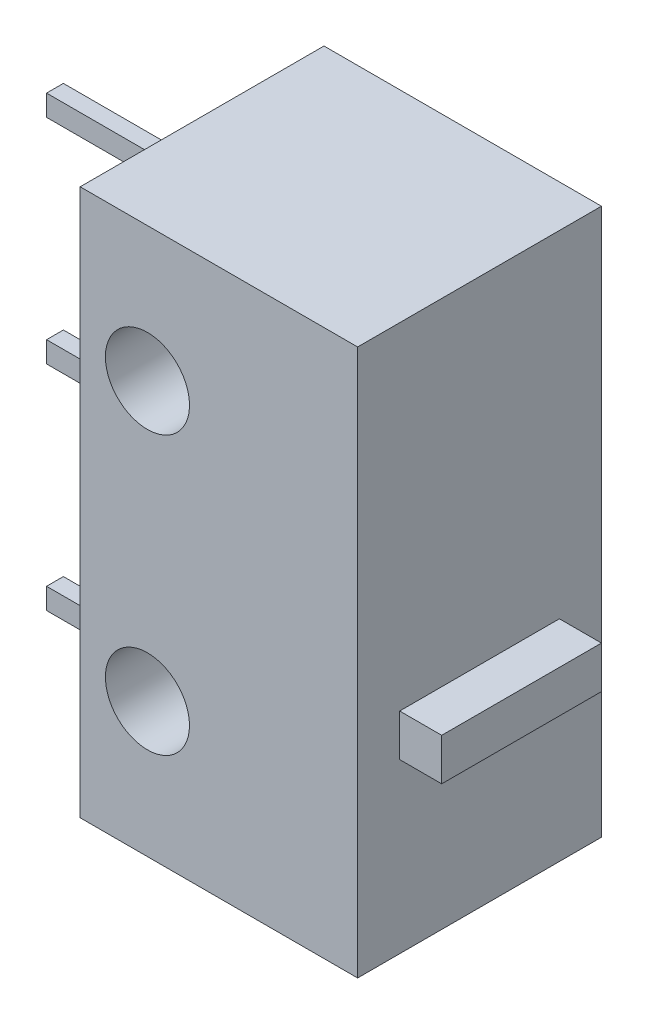
from build123d import *

# Parameters (mm, degrees)
SZKIC1_R                    = 1
DODANIE_WYCI_GNI_CIE1_DEPTH = 5.8
WYTNIJ_WYCI_GNI_CIE1_DEPTH  = 17.136914203


with BuildPart() as part:
    # Szkic1 → Dodanie-wyciągnięcie1 (new body)
    with BuildSketch(Plane.XY):
        Polygon((0, 0), (6.6, 0), (6.6, 4), (7.6, 4), (7.6, 5), (6.6, 5), (6.6, 13), (0, 13), (0, 11.83), (-3.5, 11.83), (-3.5, 11.33), (0, 11.33), (0, 6.75), (-3.5, 6.75), (-3.5, 6.25), (0, 6.25), (0, 1.67), (-3.5, 1.67), (-3.5, 1.17), (0, 1.17), align=None)
        with Locations((1.6, 3.2)):
            Circle(SZKIC1_R, mode=Mode.SUBTRACT)
        with Locations((1.6, 9.8)):
            Circle(SZKIC1_R, mode=Mode.SUBTRACT)
    extrude(amount=DODANIE_WYCI_GNI_CIE1_DEPTH)

    # Szkic2 → Wytnij-wyciągnięcie1 (cut, through all)
    with BuildSketch(Plane(origin=(0, 13, 0), x_dir=(1, 0, 0), z_dir=(0, 1, 0))):
        Polygon((6.6, 0), (6.6, -1), (7.748696563, -1), (7.748696563, -4.8), (6.6, -4.8), (6.6, -5.8), (6.6, -6.104226478), (0, -6.104226478), (0, -5.8), (0, -3.1), (-4.334557388, -3.1), (-4.334557388, -6.596588124), (0, -6.525984804), (6.6, -6.525984804), (8.404298822, -6.525984804), (8.404298822, -4.8), (8.404298822, -1), (8.474902142, -1), (8.474902142, 1.068915217), (6.6, 1.068915217), (6.6, 0.645295295), (0, 0.645295295), (-4.334557388, 0.645295295), (-4.334557388, -2.7), (0, -2.7), (0, 0), (0, 0.198321549), (6.6, 0.198321549), align=None)
    extrude(amount=-WYTNIJ_WYCI_GNI_CIE1_DEPTH, mode=Mode.SUBTRACT)


solid = part.part
